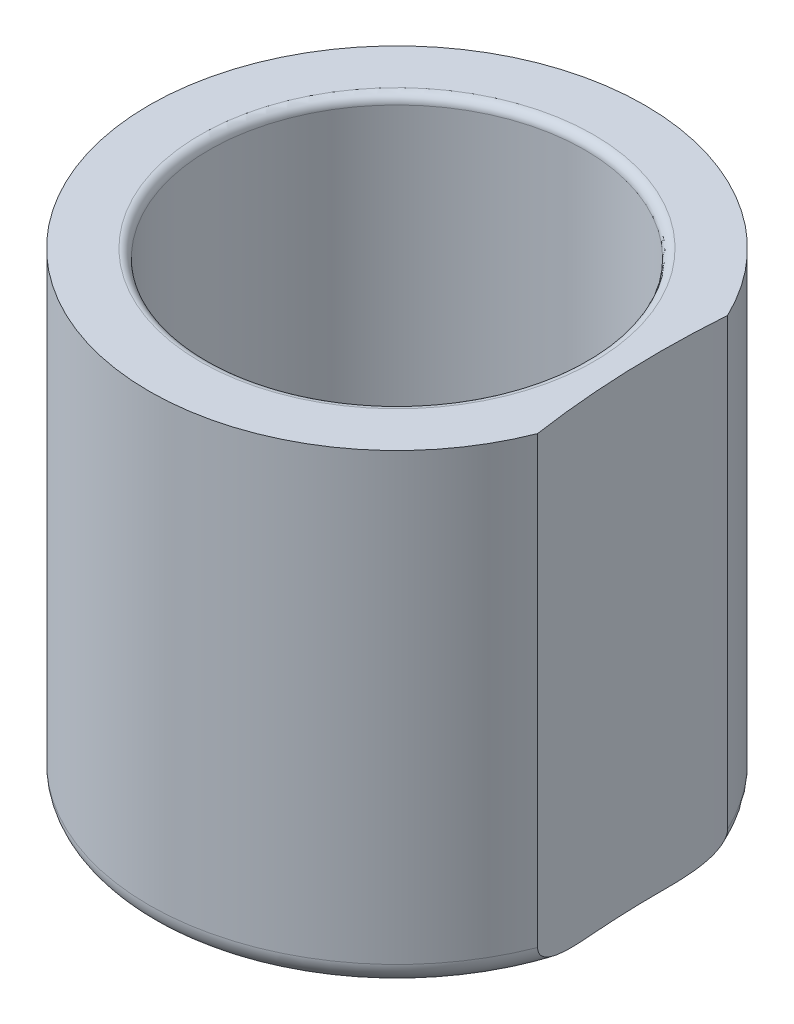
from build123d import *

# Parameters (mm, degrees)
FILLET1_R          = 1.3
SKETCH3_R          = 3
CUT_EXTRUDE1_DEPTH = 20
FILLET3_R          = 0.5
FILLET4_R          = 0.5
CAVITY1_OUTLINE_W  = 50.8
CAVITY1_OUTLINE_H  = 26.650011625


# Read off the part's stored shape, not the designer's step: Cavity1
with BuildPart() as part:
    # Sketch2 → Revolve1 (revolve)
    with BuildSketch(Plane(origin=(0, 0, 0), x_dir=(0, 0, -1), z_dir=(1, 0, 0)), mode=Mode.PRIVATE) as revolve1_sk:
        Polygon((0, 0), (14.115, 0), (14.115, 26.65), (10.7, 26.65), (10.7, 2.79), (0, 2.79), align=None)
    revolve(revolve1_sk.sketch.rotate(Axis((0, 29.213224894, 0), (0, -1, 0)), 180), axis=Axis((0, 29.213224894, 0), (0, -1, 0)))

    # Fillet1
    fillet1_edges = [part.edges().sort_by_distance(p)[0] for p in [
        (0, 0, -14.115),
    ]]
    fillet(fillet1_edges, radius=FILLET1_R)

    # Sketch3 → Cut-Extrude1 (cut)
    with BuildSketch(Plane.XY):
        with Locations((0, 6.37)):
            Circle(SKETCH3_R)
    extrude(amount=-CUT_EXTRUDE1_DEPTH, mode=Mode.SUBTRACT)

    # Fillet3
    fillet3_edges = [part.edges().sort_by_distance(p)[0] for p in [
        (0, 2.79, -10.7),
    ]]
    fillet(fillet3_edges, radius=FILLET3_R)

    # Fillet4
    fillet4_edges = [part.edges().sort_by_distance(p)[0] for p in [
        (0, 26.65, -10.7),
    ]]
    fillet(fillet4_edges, radius=FILLET4_R)

    # Cavity1 outline → Cavity1 (revolve, cut)
    with BuildSketch(Plane(origin=(63.391344809, 0, -2.353004111), x_dir=(1, 0, 0), z_dir=(0, 0, 1))):
        with Locations((25.4, 13.324994188)):
            Rectangle(CAVITY1_OUTLINE_W, CAVITY1_OUTLINE_H)
    revolve(axis=Axis((63.391344809, 0, -2.353004111), (0, 1, 0)), mode=Mode.SUBTRACT)


solid = part.part
